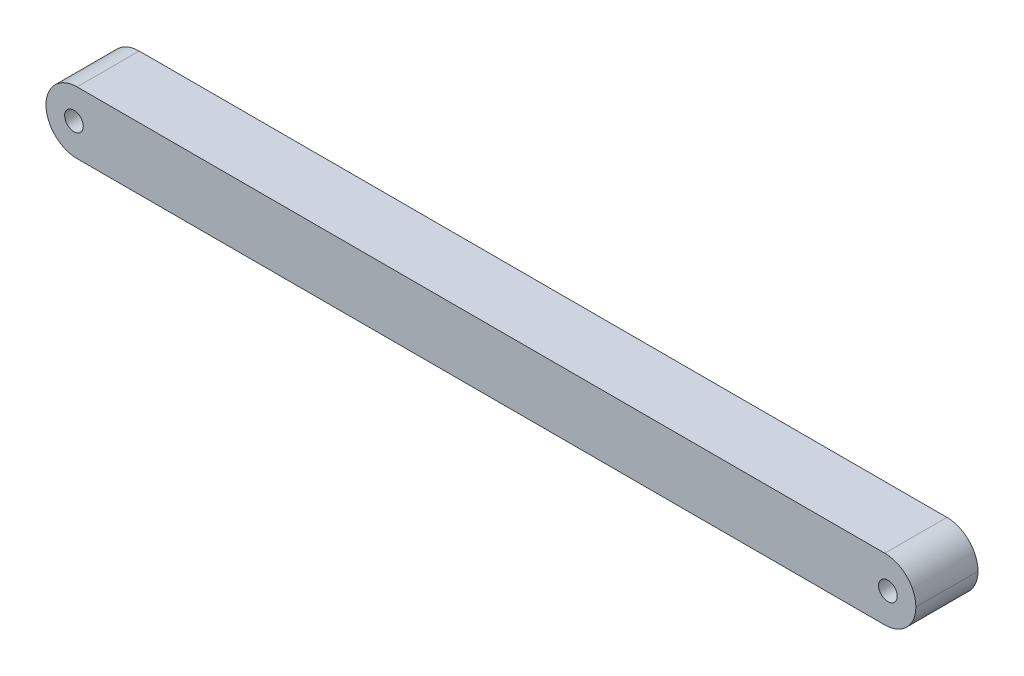
from build123d import *

# Parameters (mm, degrees)
BOSS_EXTRUDE1_DEPTH = 10
FILLET1_R           = 5
FILLET2_R           = 5
FILLET3_R           = 5
FILLET4_R           = 5


with BuildPart() as part:
    # Sketch1 → Boss-Extrude1 (new body)
    with BuildSketch(Plane.XY):
        with BuildLine():
            Line((0, 10), (0, 5))
            Line((0, 5), (3, 5))
            ThreePointArc((3, 5), (4.5, 6.5), (6, 5))
            Line((6, 5), (134, 5))
            ThreePointArc((134, 5), (135.5, 6.5), (137, 5))
            Line((137, 5), (140, 5))
            Line((140, 5), (140, 10))
            Line((140, 10), (0, 10))
        make_face()
        with BuildLine():
            Line((3, 5), (0, 5))
            Line((0, 5), (0, 0))
            Line((0, 0), (140, 0))
            Line((140, 0), (140, 5))
            Line((140, 5), (137, 5))
            ThreePointArc((137, 5), (135.5, 3.5), (134, 5))
            Line((134, 5), (6, 5))
            ThreePointArc((6, 5), (4.5, 3.5), (3, 5))
        make_face()
    extrude(amount=BOSS_EXTRUDE1_DEPTH)

    # Fillet1
    fillet1_edges = [part.edges().sort_by_distance(p)[0] for p in [
        (0, 10, 5),
    ]]
    fillet(fillet1_edges, radius=FILLET1_R)

    # Fillet2
    fillet2_edges = [part.edges().sort_by_distance(p)[0] for p in [
        (0, 0, 5),
    ]]
    fillet(fillet2_edges, radius=FILLET2_R - 0.0001)  # a hair under: the kernel refuses the full size

    # Fillet3
    fillet3_edges = [part.edges().sort_by_distance(p)[0] for p in [
        (140, 10, 5),
    ]]
    fillet(fillet3_edges, radius=FILLET3_R)

    # Fillet4
    fillet4_edges = [part.edges().sort_by_distance(p)[0] for p in [
        (140, 0, 5),
    ]]
    fillet(fillet4_edges, radius=FILLET4_R - 0.0001)  # a hair under: the kernel refuses the full size


solid = part.part
